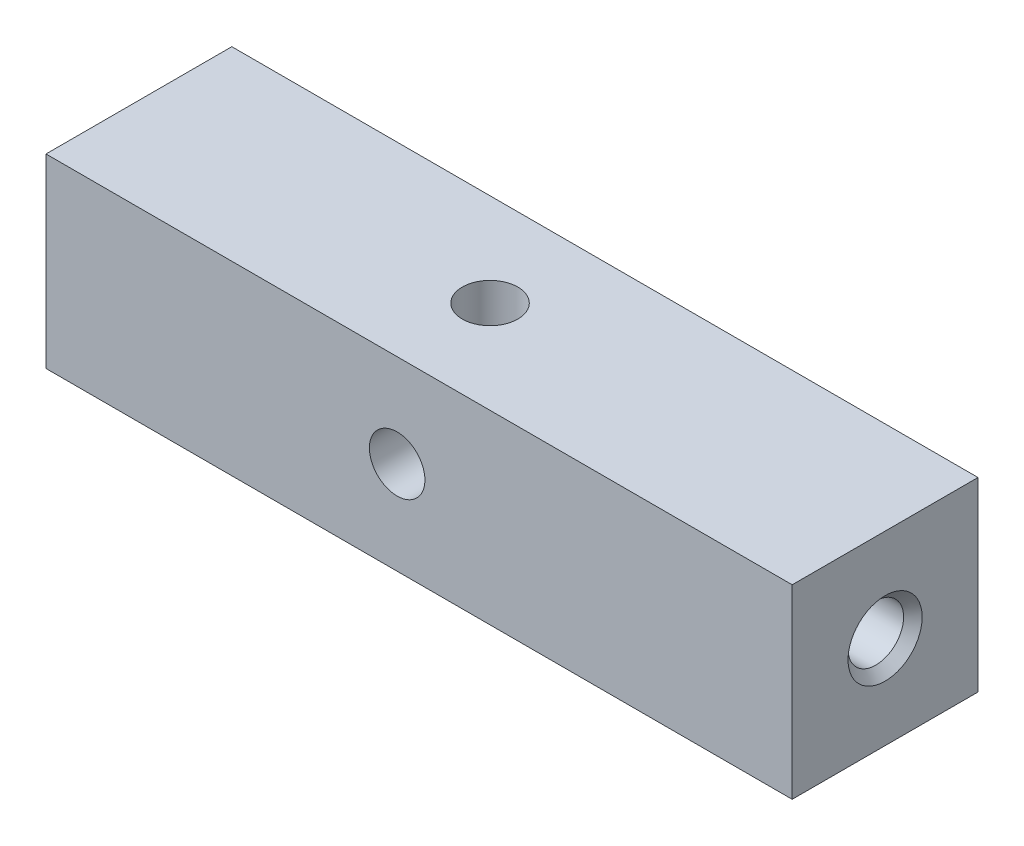
from build123d import *

# Parameters (mm, degrees)
SKETCH1_W                        = 12.7
SKETCH1_H                        = 12.7
BOSS_EXTRUDE1_DEPTH              = 51
F_10_24_TAPPED_HOLE1_D           = 3.7973
F_10_24_TAPPED_HOLE2_D           = 3.7973
M6X1_0_TAPPED_HOLE2_D            = 5
M6X1_0_TAPPED_HOLE2_DEPTH        = 20.32
M6X1_0_TAPPED_HOLE2_CSINK_D      = 6.05
M6X1_0_TAPPED_HOLE2_CSINK_ANGLE  = 90
M6X1_0_TAPPED_HOLE2_TIP          = 1.502151548
F_10_24_TAPPED_HOLE3_D           = 3.7973
F_10_24_TAPPED_HOLE3_DEPTH       = 20.574
F_10_24_TAPPED_HOLE3_CSINK_D     = 5.0673
F_10_24_TAPPED_HOLE3_CSINK_ANGLE = 90
F_10_24_TAPPED_HOLE3_TIP         = 1.140824014


with BuildPart() as part:
    # Sketch1 → Boss-Extrude1 (new body)
    with BuildSketch(Plane(origin=(0, 0, 0), x_dir=(0, 0, -1), z_dir=(1, 0, 0))):
        Rectangle(SKETCH1_W, SKETCH1_H)
    extrude(amount=BOSS_EXTRUDE1_DEPTH)

    # #10-24 Tapped Hole1 (through all)
    with Locations(Plane.XY.offset(6.35)):
        with Locations((24, 0)):
            Hole(F_10_24_TAPPED_HOLE1_D / 2)

    # #10-24 Tapped Hole2 (through all)
    with Locations(Plane(origin=(0, 6.35, 0), x_dir=(1, 0, 0), z_dir=(0, 1, 0))):
        with Locations((24, 0)):
            Hole(F_10_24_TAPPED_HOLE2_D / 2)

    # M6x1.0 Tapped Hole2
    with Locations(Plane.ZY):
        with Locations((0, 0)):
            CounterSinkHole(M6X1_0_TAPPED_HOLE2_D / 2, M6X1_0_TAPPED_HOLE2_CSINK_D / 2, depth=M6X1_0_TAPPED_HOLE2_DEPTH, counter_sink_angle=M6X1_0_TAPPED_HOLE2_CSINK_ANGLE)
            with Locations((0, 0, -(M6X1_0_TAPPED_HOLE2_DEPTH + M6X1_0_TAPPED_HOLE2_TIP / 2))):  # 118° drill point
                Cone(0, M6X1_0_TAPPED_HOLE2_D / 2, M6X1_0_TAPPED_HOLE2_TIP, mode=Mode.SUBTRACT)

    # #10-24 Tapped Hole3
    with Locations(Plane(origin=(51, 0, 0), x_dir=(0, 0, -1), z_dir=(1, 0, 0))):
        with Locations((0, 0)):
            CounterSinkHole(F_10_24_TAPPED_HOLE3_D / 2, F_10_24_TAPPED_HOLE3_CSINK_D / 2, depth=F_10_24_TAPPED_HOLE3_DEPTH, counter_sink_angle=F_10_24_TAPPED_HOLE3_CSINK_ANGLE)
            with Locations((0, 0, -(F_10_24_TAPPED_HOLE3_DEPTH + F_10_24_TAPPED_HOLE3_TIP / 2))):  # 118° drill point
                Cone(0, F_10_24_TAPPED_HOLE3_D / 2, F_10_24_TAPPED_HOLE3_TIP, mode=Mode.SUBTRACT)


solid = part.part
